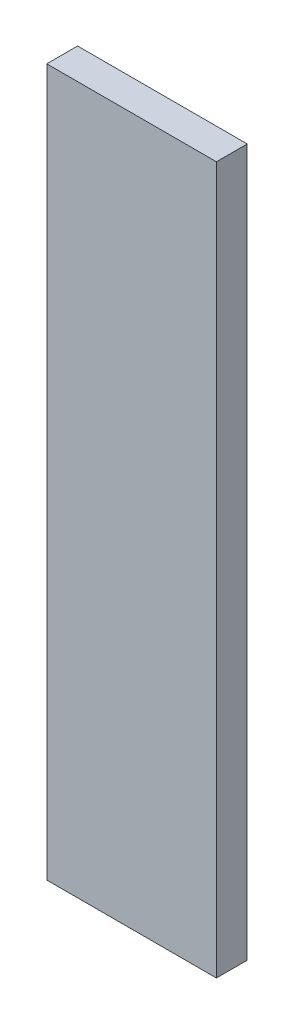
from build123d import *

# Parameters (mm, degrees)
BOSS_EXTRUDE1_DEPTH = 6
SKETCH2_W           = 66
SKETCH2_H           = 275
BOSS_EXTRUDE2_DEPTH = 6


with BuildPart() as part:
    # Sketch1 → Boss-Extrude1 (new body)
    with BuildSketch(Plane.XY):
        Polygon((23, 255), (23, 0), (43, 0), (43, 275), (-23, 275), (-23, 255), align=None)
    extrude(amount=-BOSS_EXTRUDE1_DEPTH)

    # Sketch2 → Boss-Extrude2 (add)
    with BuildSketch(Plane.XY):
        with Locations((10, 137.5)):
            Rectangle(SKETCH2_W, SKETCH2_H)
    extrude(amount=BOSS_EXTRUDE2_DEPTH)


solid = part.part
